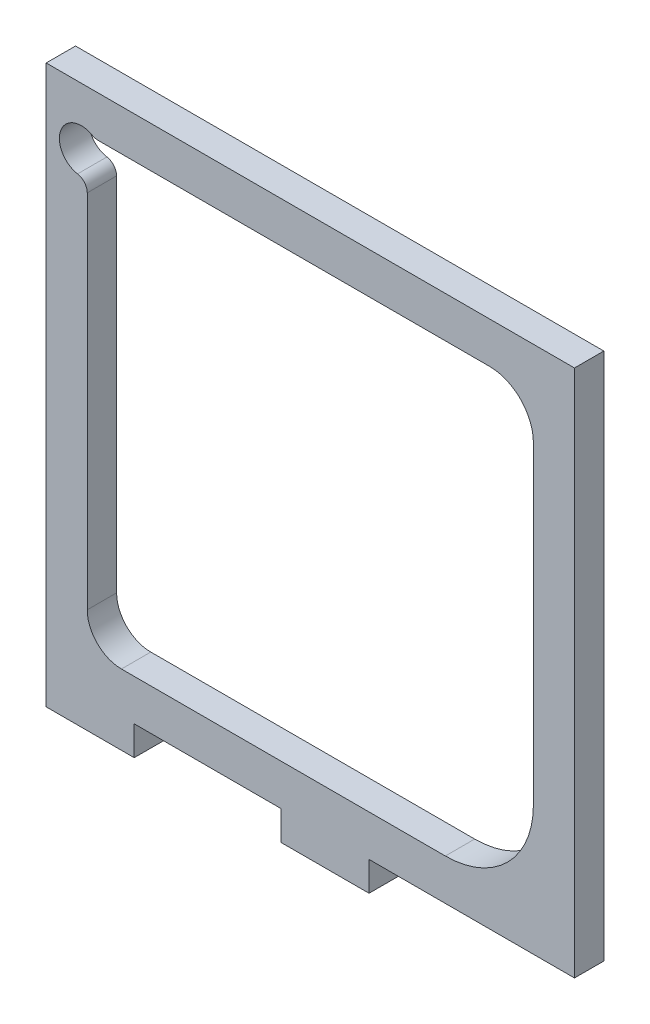
from build123d import *

# Parameters (mm, degrees)
SKETCH1_W           = 114.3
SKETCH1_H           = 114.3
BOSS_EXTRUDE1_DEPTH = 3.175
SKETCH2_W           = 19.05
SKETCH2_H           = 6.35
BOSS_EXTRUDE2_DEPTH = 6.35


with BuildPart() as part:
    # Sketch1 → Boss-Extrude1 (new, symmetric)
    with BuildSketch(Plane.XY):
        Rectangle(SKETCH1_W, SKETCH1_H)
        with BuildLine():
            Line((-40.864894547, -48.26), (17.087998711, -48.26))
            Line((17.087998711, -48.26), (29.21, -48.26))
            ThreePointArc((29.21, -48.26), (42.680384182, -42.680384182), (48.26, -29.21))
            Line((48.26, -29.21), (48.26, -17.513600374))
            Line((48.26, -17.513600374), (48.26, 38.735))
            ThreePointArc((48.26, 38.735), (45.470192091, 45.470192091), (38.735, 48.26))
            Line((38.735, 48.26), (12.317525133, 48.26))
            Line((12.317525133, 48.26), (-45.9238932, 48.26))
            ThreePointArc((-45.9238932, 48.26), (-46.572550677, 48.344222429), (-47.178191218, 48.591304348))
            ThreePointArc((-47.178191218, 48.591304348), (-54.010842502, 46.063523076), (-50.35826087, 39.760075674))
            ThreePointArc((-50.35826087, 39.760075674), (-48.854027571, 38.891201551), (-48.26, 37.2587827))
            Line((-48.26, 37.2587827), (-48.26, 4.686171691))
            Line((-48.26, 4.686171691), (-48.26, -40.864894547))
            ThreePointArc((-48.26, -40.864894547), (-46.094023761, -46.094023761), (-40.864894547, -48.26))
        make_face(mode=Mode.SUBTRACT)
    extrude(amount=BOSS_EXTRUDE1_DEPTH, both=True)

    # Sketch2 → Boss-Extrude2 (add)
    with BuildSketch(Plane.XZ.offset(57.15)):
        with Locations((3.175, 0)):
            Rectangle(SKETCH2_W, SKETCH2_H)
        with Locations((-47.625, 0)):
            Rectangle(SKETCH2_W, SKETCH2_H)
    extrude(amount=BOSS_EXTRUDE2_DEPTH)


solid = part.part
